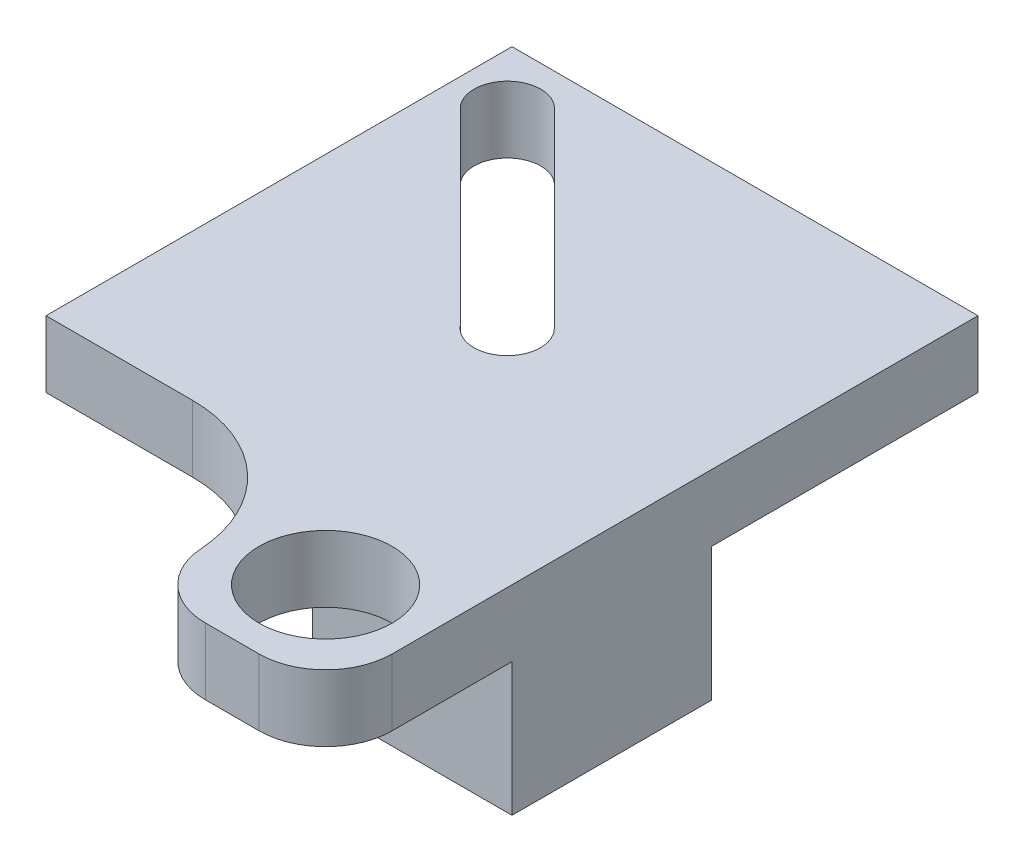
from build123d import *

# Parameters (mm, degrees)
SKETCH1_R           = 5
BOSS_EXTRUDE1_DEPTH = 5
BOSS_EXTRUDE2_DEPTH = 10
FILLET1_R           = 10
FILLET4_R           = 5


with BuildPart() as part:
    # Sketch1 → Boss-Extrude1 (new body)
    with BuildSketch(Plane(origin=(0, 0, 0), x_dir=(1, 0, 0), z_dir=(0, 1, 0))):
        Polygon((0, 0), (0, 35), (35, 35), (35, 0), (35, -14), (21, -14), (21, 0), align=None)
        with Locations(Location((28, -7, 0), (0, 0, 270))):
            Circle(SKETCH1_R, mode=Mode.SUBTRACT)
        with BuildLine():
            Line((5.77728435, 32.399644503), (19.919419974, 18.257508879))
            ThreePointArc((19.919419974, 18.257508879), (19.829534471, 14.632089471), (16.21302376, 14.901525103))
            Line((16.21302376, 14.901525103), (2.070888136, 29.043660727))
            ThreePointArc((2.070888136, 29.043660727), (2.160773638, 32.669080135), (5.77728435, 32.399644503))
        make_face(mode=Mode.SUBTRACT)
    extrude(amount=BOSS_EXTRUDE1_DEPTH)

    # Sketch2 → Boss-Extrude2 (add)
    with BuildSketch(Plane.XZ):
        Polygon((30, -5), (20, -5), (20, 0), (35, 0), (35, -15), (30, -15), align=None)
    extrude(amount=BOSS_EXTRUDE2_DEPTH)

    # Fillet1
    # the kernel refuses this fillet: 10 mm, written as the material it adds along each edge
    with BuildSketch(Plane(origin=(21, 0, 0), x_dir=(-1, 0, 0), z_dir=(0, 1, 0))) as fillet1_piece_1:
        with BuildLine():
            CenterArc((FILLET1_R, FILLET1_R), FILLET1_R, 180, 90)
            Line((0, FILLET1_R), (0, 0))
            Line((0, 0), (FILLET1_R, 0))
        make_face()
    extrude(amount=5)

    # Fillet4
    fillet4_edges = [part.edges().sort_by_distance(p)[0] for p in [
        (35, 2.5, 14),
        (21, 2.5, 14),
    ]]
    fillet(fillet4_edges, radius=FILLET4_R)


solid = part.part
